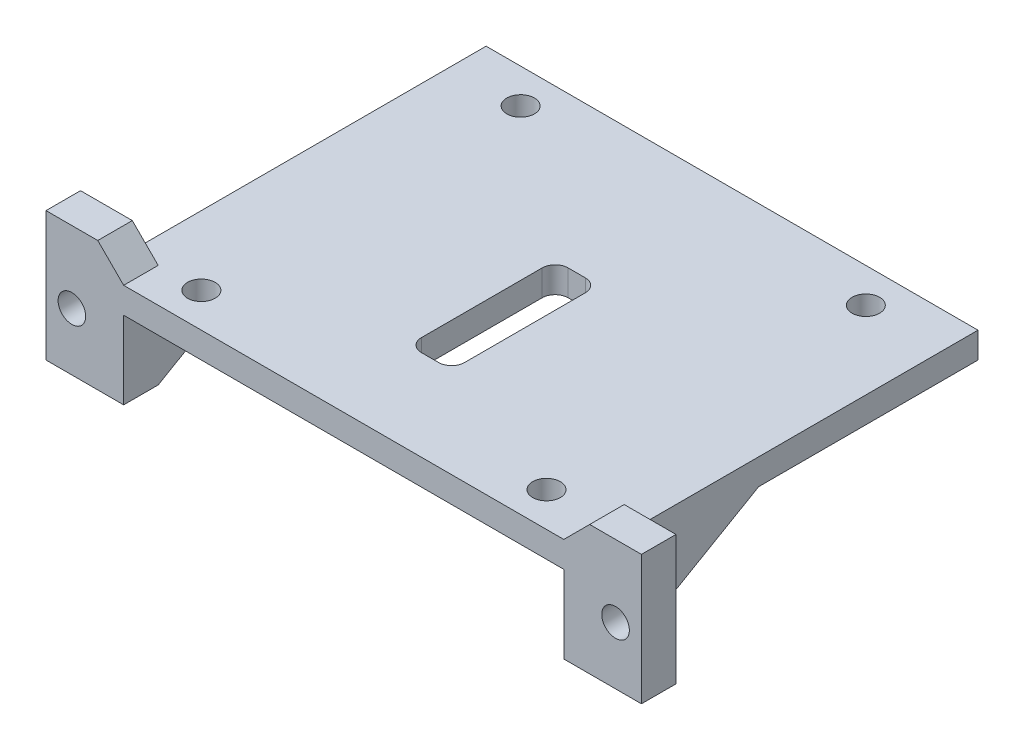
from build123d import *

# Parameters (mm, degrees)
SKETCH_1_W          = 57
SKETCH_1_H          = 45
EXTRUDE_1_DEPTH     = 3
SKETCH_2_W          = 4
SKETCH_2_H          = 15
EXTRUDE_2_DEPTH     = 6
SKETCH_3_W          = 4
SKETCH_3_H          = 15
EXTRUDE_3_DEPTH     = 6
EXTRUDE_4_DEPTH     = 3
SKETCH_5_W          = 4
SKETCH_5_H          = 9
EXTRUDE_5_DEPTH     = 3
CHAMFER_1_SIZE      = 3
SKETCH_6_R          = 1.6
CUT_EXTRUDE_1_DEPTH = 4
SKETCH_7_R          = 1.6
CUT_EXTRUDE_2_DEPTH = 3
SKETCH_8_W          = 8
SKETCH_8_H          = 3
EXTRUDE_6_DEPTH     = 9
EXTRUDE_7_DEPTH     = 3
EXTRUDE_8_DEPTH     = 3
SKETCH_11_R         = 1.6
CUT_EXTRUDE_3_DEPTH = 3
SKETCH_12_W         = 5
SKETCH_12_H         = 17
CUT_EXTRUDE_4_DEPTH = 3
FILLET_1_R          = 1.5


with BuildPart() as part:
    # 草图1 → 凸台-拉伸1 (new body)
    with BuildSketch(Plane(origin=(0, 0, 0), x_dir=(1, 0, 0), z_dir=(0, 1, 0))):
        with Locations((28.5, 22.5)):
            Rectangle(SKETCH_1_W, SKETCH_1_H)
    extrude(amount=EXTRUDE_1_DEPTH)

    # 草图2 → 凸台-拉伸2 (add)
    with BuildSketch(Plane.ZY):
        with Locations((-2, -1.5)):
            Rectangle(SKETCH_2_W, SKETCH_2_H)
    extrude(amount=EXTRUDE_2_DEPTH)

    # 草图3 → 凸台-拉伸3 (add)
    with BuildSketch(Plane(origin=(57, 0, 0), x_dir=(0, 0, -1), z_dir=(1, 0, 0))):
        with Locations((2, -1.5)):
            Rectangle(SKETCH_3_W, SKETCH_3_H)
    extrude(amount=EXTRUDE_3_DEPTH)

    # 草图4 → 凸台-拉伸4 (add)
    with BuildSketch(Plane.ZY.offset(-57)):
        Polygon((-4, -9), (-19.588457268, 0), (0, 0), (0, -9), align=None)
    extrude(amount=EXTRUDE_4_DEPTH)

    # 草图5 → 凸台-拉伸5 (add)
    with BuildSketch(Plane(origin=(0, 0, 0), x_dir=(0, 0, -1), z_dir=(1, 0, 0))):
        Polygon((19.588457268, 0), (4, 0), (4, -9), align=None)
        with Locations((2, -4.5)):
            Rectangle(SKETCH_5_W, SKETCH_5_H)
    extrude(amount=EXTRUDE_5_DEPTH)

    # 倒角1
    chamfer_1_edges = [part.edges().sort_by_distance(p)[0] for p in [
        (0, 3, -2),
        (57, 3, -2),
    ]]
    chamfer(chamfer_1_edges, length=CHAMFER_1_SIZE - 0.0001)  # a hair under: the kernel refuses the full size

    # 草图6 → 切除-拉伸1 (cut)
    with BuildSketch(Plane(origin=(0, 0, -4), x_dir=(-1, 0, 0), z_dir=(0, 0, -1))):
        with Locations(Location((3, -2.323268139, 0), (0, 0, 90))):
            Circle(SKETCH_6_R)
        with Locations(Location((-60, -2.323268139, 0), (0, 0, 90))):
            Circle(SKETCH_6_R)
    extrude(amount=-CUT_EXTRUDE_1_DEPTH, mode=Mode.SUBTRACT)

    # 草图7 → 切除-拉伸2 (cut)
    with BuildSketch(Plane(origin=(0, 3, 0), x_dir=(1, 0, 0), z_dir=(0, 1, 0))):
        with Locations(Location((8, 41, 0), (0, 0, 270))):
            Circle(SKETCH_7_R)
        with Locations(Location((8, 4, 0), (0, 0, 270))):
            Circle(SKETCH_7_R)
        with Locations(Location((48, 4, 0), (0, 0, 270))):
            Circle(SKETCH_7_R)
        with Locations(Location((48, 41, 0), (0, 0, 270))):
            Circle(SKETCH_7_R)
    extrude(amount=-CUT_EXTRUDE_2_DEPTH, mode=Mode.SUBTRACT)

    # 草图8 → 凸台-拉伸6 (add)
    with BuildSketch(Plane.XZ):
        with Locations((28, -43.5)):
            Rectangle(SKETCH_8_W, SKETCH_8_H)
    extrude(amount=EXTRUDE_6_DEPTH)

    # 草图9 → 凸台-拉伸7 (add)
    with BuildSketch(Plane(origin=(32, 0, 0), x_dir=(0, 0, -1), z_dir=(1, 0, 0))):
        Polygon((45, 0), (29.146667939, 0), (42, -9), (45, -9), align=None)
    extrude(amount=EXTRUDE_7_DEPTH)

    # 草图10 → 凸台-拉伸8 (add)
    with BuildSketch(Plane.ZY.offset(-24)):
        Polygon((-45, 0), (-45, -9), (-42, -9), (-29.146667939, 0), align=None)
    extrude(amount=EXTRUDE_8_DEPTH)

    # 草图11 → 切除-拉伸3 (cut)
    with BuildSketch(Plane.XY.offset(-42)):
        with Locations((28, -4.5)):
            Circle(SKETCH_11_R)
    extrude(amount=-CUT_EXTRUDE_3_DEPTH, mode=Mode.SUBTRACT)

    # 草图12 → 切除-拉伸4 (cut)
    with BuildSketch(Plane(origin=(0, 3, 0), x_dir=(1, 0, 0), z_dir=(0, 1, 0))):
        with Locations((28, 19)):
            Rectangle(SKETCH_12_W, SKETCH_12_H)
    extrude(amount=-CUT_EXTRUDE_4_DEPTH, mode=Mode.SUBTRACT)

    # 圆角1
    fillet_1_edges = [part.edges().sort_by_distance(p)[0] for p in [
        (25.5, 1.5, -27.5),
        (30.5, 1.5, -27.5),
        (30.5, 1.5, -10.5),
        (25.5, 1.5, -10.5),
    ]]
    fillet(fillet_1_edges, radius=FILLET_1_R)


solid = part.part
